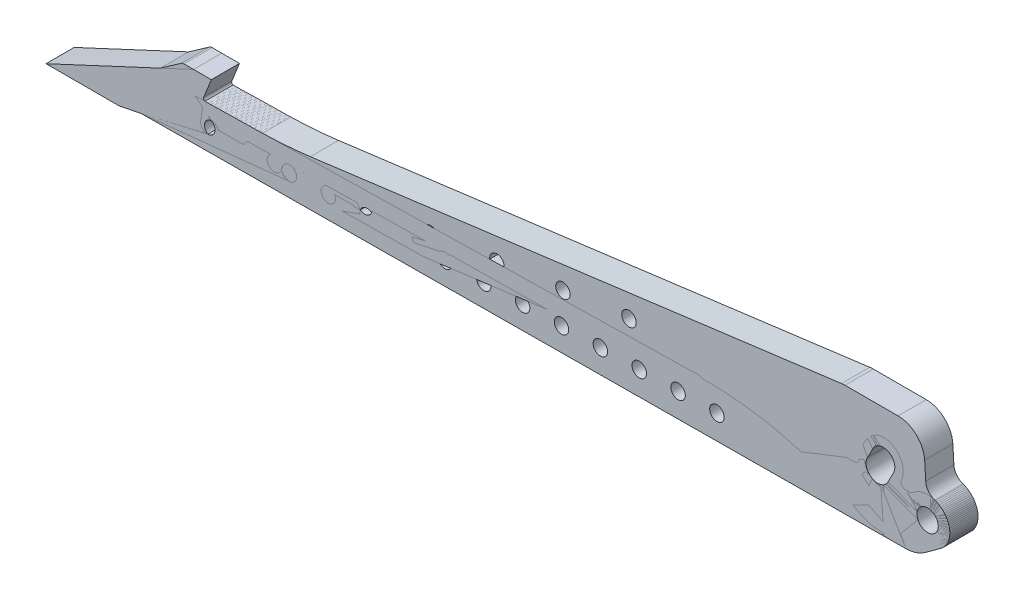
from build123d import *
from build123d.topology import SkipClean

# Parameters (mm, degrees)
SKETCH1_R                        = 3.2639
SKETCH1_R_2                      = 4.8025
BOSS_EXTRUDE1_DEPTH              = 12.7
EXTRUDE_THIN1_DEPTH              = 12.7
FILLET6_R                        = 2
FILLET3_R                        = 1
FILLET4_R                        = 2
BOSS_EXTRUDE5_START              = -12.7
BOSS_EXTRUDE5_DEPTH              = 12.7
CUT_EXTRUDE8_START               = -12.7
CUT_EXTRUDE8_DEPTH               = 12.7
FILLET13_R                       = 100
FILLET14_R                       = 2
CUT_EXTRUDE10_DEPTH              = 12.7
SKETCH19_R                       = 3.2639
BOSS_EXTRUDE7_DEPTH              = 6.35
FILLET17_R                       = 10
FILLET18_R                       = 5
CUT_EXTRUDE11_DEPTH              = 405.745522146
FILLET19_R                       = 5
DELETEFACE2_DEPTH                = 12.7
FILLET20_R                       = 15
BODY_MOVE_COPY1_OUTLINE_R        = 3.2639
BODY_MOVE_COPY1_OUTLINE_R_2      = 4.8025
BODY_MOVE_COPY1_DEPTH            = 12.7
BOSS_EXTRUDE8_DEPTH              = 12.7
FILLET21_R                       = 6
DELETEFACE3_OUTLINE_R            = 3.2639
DELETEFACE3_DEPTH                = 12.7
CUT_EXTRUDE12_DEPTH              = 378.065765561
FILLET22_R                       = 150
FILLET22_R_2                     = 30
FILLET22_R_3                     = 8
DELETEFACE4_DEPTH                = 12.7
MOVE_FACE1_DEPTH                 = 12.7
MOVE_FACE2_DEPTH                 = 12.7
MOVE_FACE2_2_DEPTH               = 12.7
FILLET23_R                       = 12
SKETCH25_W                       = 3.2639
SKETCH25_H                       = 12.7
F_1_4_CLEARANCE_HOLE1_AT_2_COUNT = 2
F_1_4_CLEARANCE_HOLE1_AT_2_PITCH = 40.943805732
F_1_4_CLEARANCE_HOLE1_AT_3_COUNT = 2
F_1_4_CLEARANCE_HOLE1_AT_3_PITCH = 70.874481639
F_1_4_CLEARANCE_HOLE1_AT_4_COUNT = 2
F_1_4_CLEARANCE_HOLE1_AT_4_PITCH = 120
F_1_4_CLEARANCE_HOLE1_AT_5_COUNT = 2
F_1_4_CLEARANCE_HOLE1_AT_5_PITCH = 90
F_1_4_CLEARANCE_HOLE1_AT_6_COUNT = 2
F_1_4_CLEARANCE_HOLE1_AT_6_PITCH = 60
F_1_4_CLEARANCE_HOLE1_AT_7_COUNT = 2
F_1_4_CLEARANCE_HOLE1_AT_7_PITCH = 30


# Read off the part's stored shape, not the designer's step: DeleteFace2, Body-Move/Copy1, DeleteFace3, DeleteFace4, Move Face1, Move Face2
with BuildPart() as part:
    # Sketch1 → Boss-Extrude1 (new body)
    with BuildSketch(Plane.XY):
        with BuildLine():
            Line((-356.801436578, 66.762186411), (-341.101436578, 66.762186411))
            Line((-341.101436578, 66.762186411), (-331.101436578, 68.762186411))
            Line((-331.101436578, 68.762186411), (18.198563422, 71.262186411))
            Line((18.198563422, 71.262186411), (29.067448443, 79.140508783))
            ThreePointArc((29.067448443, 79.140508783), (30.773671377, 93.765412775), (16.057134994, 94.237186411))
            Line((16.057134994, 94.237186411), (-308.528848369, 87.762186411))
            Line((-308.528848369, 87.762186411), (-304.528848369, 97.762186411))
            Line((-304.528848369, 97.762186411), (-312.528848369, 97.762186411))
            Line((-312.528848369, 97.762186411), (-356.801436578, 66.762186411))
        make_face()
        with Locations((-299.351436578, 78.467884124)):
            Circle(SKETCH1_R, mode=Mode.SUBTRACT)
        with Locations((-281.841436578, 78.705086211)):
            Circle(SKETCH1_R, mode=Mode.SUBTRACT)
        with Locations((-264.331436578, 78.942288297)):
            Circle(SKETCH1_R, mode=Mode.SUBTRACT)
        with Locations((-246.821436578, 79.179490384)):
            Circle(SKETCH1_R, mode=Mode.SUBTRACT)
        with Locations((-229.311436578, 79.41669247)):
            Circle(SKETCH1_R, mode=Mode.SUBTRACT)
        with Locations((-211.801436578, 79.653894557)):
            Circle(SKETCH1_R, mode=Mode.SUBTRACT)
        with BuildLine():
            ThreePointArc((-197.555037136, 79.846885743), (-194.335647478, 83.154697202), (-191.027836019, 79.935307544))
            ThreePointArc((-191.027836019, 79.935307544), (-194.247225677, 76.627496085), (-197.555037136, 79.846885743))
        make_face(mode=Mode.SUBTRACT)
        with BuildLine():
            ThreePointArc((-180.045037136, 80.08408783), (-176.825647478, 83.391899289), (-173.517836019, 80.17250963))
            ThreePointArc((-173.517836019, 80.17250963), (-176.737225677, 76.864698172), (-180.045037136, 80.08408783))
        make_face(mode=Mode.SUBTRACT)
        with BuildLine():
            ThreePointArc((-162.535037136, 80.321289917), (-159.315647478, 83.629101376), (-156.007836019, 80.409711717))
            ThreePointArc((-156.007836019, 80.409711717), (-159.227225677, 77.101900258), (-162.535037136, 80.321289917))
        make_face(mode=Mode.SUBTRACT)
        with BuildLine():
            ThreePointArc((-145.025037136, 80.558492003), (-141.805647478, 83.866303462), (-138.497836019, 80.646913804))
            ThreePointArc((-138.497836019, 80.646913804), (-141.717225677, 77.339102345), (-145.025037136, 80.558492003))
        make_face(mode=Mode.SUBTRACT)
        with Locations((-124.251436578, 80.83990499)):
            Circle(SKETCH1_R, mode=Mode.SUBTRACT)
        with Locations((-106.743043005, 81.077085315)):
            Circle(SKETCH1_R, mode=Mode.SUBTRACT)
        with Locations((-89.234649432, 81.31426564)):
            Circle(SKETCH1_R, mode=Mode.SUBTRACT)
        with Locations((-71.724649432, 81.551467727)):
            Circle(SKETCH1_R, mode=Mode.SUBTRACT)
        with BuildLine():
            ThreePointArc((-56.765451624, 76.725809773), (-61.828921392, 81.685493615), (-56.901716563, 86.780573837))
            Line((-56.901716563, 86.780573837), (11.656240235, 88.148201501))
            Line((11.656240235, 88.148201501), (15.713451777, 77.244553714))
            Line((15.713451777, 77.244553714), (-56.765451624, 76.725809773))
        make_face(mode=Mode.SUBTRACT)
        with Locations((23.198563422, 87.237186411)):
            Circle(SKETCH1_R_2, mode=Mode.SUBTRACT)
    extrude(amount=BOSS_EXTRUDE1_DEPTH)

    # Sketch3 → Extrude-Thin1 (add)
    with BuildSketch(Plane.XY.offset(12.7)):
        Polygon((4.266451459, 91.146855042), (3.251292658, 89.42364507), (-3.17085029, 78.522197177), (-4.186009091, 76.798987205), (0.552818334, 74.007300502), (1.567977134, 75.730510475), (7.990120082, 86.631958367), (9.005278883, 88.35516834), align=None)
        Polygon((-7.409121997, 76.81721423), (-8.469584737, 78.512920212), (-15.045003552, 89.027176482), (-16.105466292, 90.722882464), (-20.768657742, 87.806609928), (-19.708195001, 86.110903946), (-13.132776187, 75.596647676), (-12.072313446, 73.900941694), align=None)
        Polygon((-55.76358933, 87.210989988), (-54.70312659, 85.515284006), (-48.127707775, 75.001027736), (-47.067245035, 73.305321754), (-42.404053585, 76.22159429), (-43.464516326, 77.917300272), (-50.03993514, 88.431556542), (-51.100397881, 90.127262523), align=None)
        Polygon((-30.72848013, 90.551235102), (-31.743638931, 88.828025129), (-38.165781878, 77.926577237), (-39.180940679, 76.203367264), (-34.442113255, 73.411680562), (-33.426954454, 75.134890534), (-27.004811507, 86.036338427), (-25.989652706, 87.759548399), align=None)
    extrude(amount=-EXTRUDE_THIN1_DEPTH)

    # Fillet6
    fillet6_edges = [part.edges().sort_by_distance(p)[0] for p in [
        (-4.006668809, 77.103413429, 6.35),
        (2.391033949, 87.963374633, 6.35),
        (2.403795654, 77.149294223, 6.35),
        (8.850378791, 88.092228804, 6.35),
        (-14.030214252, 77.031673195, 6.35),
        (-20.580120846, 87.505134799, 6.35),
        (-7.572146672, 77.077894693, 6.35),
        (-14.173077707, 87.63294563, 6.35),
        (-38.797405337, 76.854410162, 6.35),
        (-32.664985126, 87.264060013, 6.35),
        (-32.386940873, 76.900290955, 6.35),
        (-26.205640285, 87.392914184, 6.35),
        (-49.240037595, 76.779670452, 6.35),
        (-55.511755473, 86.808301461, 6.35),
        (-42.781970016, 76.825891949, 6.35),
        (-49.104712334, 86.936112292, 6.35),
        (15.713451777, 77.244553714, 6.35),
        (11.656240235, 88.148201501, 6.35),
    ]]
    fillet(fillet6_edges, radius=FILLET6_R)

    # Fillet3
    fillet3_edges = [part.edges().sort_by_distance(p)[0] for p in [
        (-308.528848369, 87.762186411, 6.35),
    ]]
    fillet(fillet3_edges, radius=FILLET3_R)

    # Fillet4
    fillet4_edges = [part.edges().sort_by_distance(p)[0] for p in [
        (-312.528848369, 97.762186411, 6.35),
    ]]
    fillet(fillet4_edges, radius=FILLET4_R)

    # Sketch15 → Boss-Extrude5 (add)
    with BuildSketch(Plane(origin=(0, 0, 0), x_dir=(-1, 0, 0), z_dir=(0, 0, -1)).offset(BOSS_EXTRUDE5_START)):
        with BuildLine():
            ThreePointArc((-10.673905671, 95.845145196), (-10.129865813, 94.994321774), (-9.643534088, 94.109244762))
            Line((-9.643534088, 94.109244762), (-5.716381864, 94.030904008))
            ThreePointArc((-5.716381864, 94.030904008), (-5.937204944, 95.011972339), (-5.966921788, 96.01714636))
            ThreePointArc((-5.966921788, 96.01714636), (-5.552957699, 105.137562008), (2.068935542, 100.111620178))
            ThreePointArc((2.068935542, 100.111620178), (4.245314576, 97.349429423), (4.190127672, 93.833284109))
            Line((4.190127672, 93.833284109), (8.099749475, 93.755293061))
            ThreePointArc((8.099749475, 93.755293061), (8.195599303, 95.99531307), (7.722434089, 98.186885911))
            ThreePointArc((7.722434089, 98.186885911), (6.028678087, 102.129209778), (3.83483588, 105.816726997))
            ThreePointArc((3.83483588, 105.816726997), (-8.405325796, 108.085306872), (-10.673905671, 95.845145196))
        make_face()
        with BuildLine():
            ThreePointArc((1.190174188, 87.891934941), (-0.035420742, 87.502954243), (-0.770907429, 86.448227619))
            ThreePointArc((-0.770907429, 86.448227619), (1.801029811, 86.772839148), (4.166878038, 87.832554196))
            Line((4.166878038, 87.832554196), (1.190174188, 87.891934941))
        make_face()
    extrude(amount=BOSS_EXTRUDE5_DEPTH)

    # Sketch15<3> → Cut-Extrude8 (cut)
    with SkipClean():  # the faces are left unmerged after this step: merging them gives an invalid solid
        with BuildSketch(Plane(origin=(0, 0, 0), x_dir=(-1, 0, 0), z_dir=(0, 0, -1)).offset(CUT_EXTRUDE8_START)):
            with BuildLine():
                Line((4.190127672, 93.833284109), (-5.716381864, 94.030904008))
                ThreePointArc((-5.716381864, 94.030904008), (-0.833187407, 90.420033069), (4.190127672, 93.833284109))
            make_face()
        extrude(amount=CUT_EXTRUDE8_DEPTH, mode=Mode.SUBTRACT)

    # Fillet13
    fillet13_edges = [part.edges().sort_by_distance(p)[0] for p in [
        (5.966921788, 96.01714636, 6.35),
        (-2.068935542, 100.111620178, 6.35),
    ]]
    fillet(fillet13_edges, radius=FILLET13_R)

    # Fillet14
    fillet14_edges = [part.edges().sort_by_distance(p)[0] for p in [
        (16.057134994, 94.237186411, 6.35),
        (-8.099749475, 93.755293061, 6.35),
        (9.643534088, 94.109244762, 6.35),
    ]]
    fillet(fillet14_edges, radius=FILLET14_R)

    # original slant → Cut-Extrude10 (cut)
    with SkipClean():  # the faces are left unmerged after this step: merging them gives an invalid solid
        with BuildSketch(Plane(origin=(0, 0, 0), x_dir=(-1, 0, 0), z_dir=(0, 0, -1))):
            with BuildLine():
                Line((28.684666066, 98.558006822), (7.106994943, 99.790159701))
                ThreePointArc((7.106994943, 99.790159701), (7.671727903, 97.779168258), (7.746735366, 95.691733522))
                ThreePointArc((7.746735366, 95.691733522), (8.24962771, 94.192022343), (9.684666066, 93.526665861))
                Line((9.684666066, 93.526665861), (28.684666066, 93.002231288))
                Line((28.684666066, 93.002231288), (28.684666066, 98.558006822))
            make_face()
            Polygon((67.354716499, 96.349825333), (28.684666066, 98.558006822), (28.684666066, 93.002231288), (67.354716499, 93.002231288), align=None)
        extrude(amount=-CUT_EXTRUDE10_DEPTH, mode=Mode.SUBTRACT)

    # DeleteFace2 outline → DeleteFace2 (add)
    with SkipClean():  # the faces are left unmerged after this step: merging them gives an invalid solid
        with BuildSketch(Plane.XY):
            with BuildLine():
                ThreePointArc((-56.901716563, 86.780573837), (-61.828921392, 81.685493615), (-56.765451624, 76.725809773))
                Line((-56.765451624, 76.725809773), (-52.81933282, 76.754052822))
                ThreePointArc((-52.81933282, 76.754052822), (-51.080771522, 77.790970825), (-51.137940814, 79.814464339))
                Line((-51.137940814, 79.814464339), (-54.910286581, 85.846537921))
                ThreePointArc((-54.910286581, 85.846537921), (-55.654189981, 86.545072579), (-56.645881605, 86.785677358))
                Line((-56.645881605, 86.785677358), (-56.901716563, 86.780573837))
            make_face()
            with BuildLine():
                ThreePointArc((-43.374508777, 77.77337599), (-42.64183357, 77.080963456), (-41.664488819, 76.833889954))
                Line((-41.664488819, 76.833889954), (-39.930931875, 76.846297318))
                ThreePointArc((-39.930931875, 76.846297318), (-38.946646737, 77.113387241), (-38.222035879, 77.831087294))
                Line((-38.222035879, 77.831087294), (-34.483094249, 84.177859344))
                ThreePointArc((-34.483094249, 84.177859344), (-34.47986619, 86.202677357), (-36.246193264, 87.192620321))
                Line((-36.246193264, 87.192620321), (-45.579170729, 87.006441521))
                ThreePointArc((-45.579170729, 87.006441521), (-47.298279084, 85.958641926), (-47.234987668, 83.946376604))
                Line((-47.234987668, 83.946376604), (-43.374508777, 77.77337599))
            make_face()
            with BuildLine():
                ThreePointArc((-30.595835387, 79.940653539), (-30.605484269, 77.926895623), (-28.858311438, 76.925545961))
                Line((-28.858311438, 76.925545961), (-17.609509476, 77.006055566))
                ThreePointArc((-17.609509476, 77.006055566), (-15.870948178, 78.042973568), (-15.928117471, 80.066467083))
                Line((-15.928117471, 80.066467083), (-19.978651954, 86.543371259))
                ThreePointArc((-19.978651954, 86.543371259), (-20.722555354, 87.241905917), (-21.714246978, 87.482510696))
                Line((-21.714246978, 87.482510696), (-25.089143083, 87.415186617))
                ThreePointArc((-25.089143083, 87.415186617), (-26.058913252, 87.142022472), (-26.772464013, 86.430743241))
                Line((-26.772464013, 86.430743241), (-30.595835387, 79.940653539))
            make_face()
            with BuildLine():
                ThreePointArc((-8.164685434, 78.025378734), (-7.432010227, 77.3329662), (-6.454665476, 77.085892697))
                Line((-6.454665476, 77.085892697), (-5.140195348, 77.095300585))
                ThreePointArc((-5.140195348, 77.095300585), (-4.15591021, 77.362390508), (-3.431299352, 78.080090561))
                Line((-3.431299352, 78.080090561), (0.572924826, 84.877173964))
                ThreePointArc((0.572924826, 84.877173964), (0.834020748, 85.64227253), (0.770907429, 86.448227619))
                ThreePointArc((0.770907429, 86.448227619), (-1.801029811, 86.772839148), (-4.166878038, 87.832554196))
                Line((-4.166878038, 87.832554196), (-10.647536102, 87.703274859))
                ThreePointArc((-10.647536102, 87.703274859), (-12.366644457, 86.655475264), (-12.303353041, 84.643209942))
                Line((-12.303353041, 84.643209942), (-8.164685434, 78.025378734))
            make_face()
            with BuildLine():
                ThreePointArc((4.19490114, 80.189656806), (4.185252259, 78.175898891), (5.932425089, 77.174549229))
                Line((5.932425089, 77.174549229), (12.857228918, 77.224111237))
                ThreePointArc((12.857228918, 77.224111237), (14.48938723, 78.088661845), (14.717356381, 79.921533519))
                Line((14.717356381, 79.921533519), (12.151293007, 86.817760384))
                ThreePointArc((12.151293007, 86.817760384), (11.401698398, 87.773985644), (10.236962525, 88.119889055))
                Line((10.236962525, 88.119889055), (9.966875992, 88.114501237))
                ThreePointArc((9.966875992, 88.114501237), (8.997105823, 87.841337091), (8.283555062, 87.130057861))
                Line((8.283555062, 87.130057861), (4.19490114, 80.189656806))
            make_face()
        extrude(amount=DELETEFACE2_DEPTH)

    # Fillet20
    fillet20_edges = [part.edges().sort_by_distance(p)[0] for p in [
        (18.198563422, 71.262186411, 6.35),
    ]]
    fillet(fillet20_edges, radius=FILLET20_R)

    # Sketch21 → Boss-Extrude8 (add)
    with SkipClean():  # the faces are left unmerged after this step: merging them gives an invalid solid
        with BuildSketch(Plane(origin=(0, 0, 0), x_dir=(-1, 0, 0), z_dir=(0, 0, -1))):
            with BuildLine():
                Line((254.917284333, 90.029419342), (14.801436578, 121.284938536))
                Line((14.801436578, 121.284938536), (-21.198563422, 121.284938536))
                Line((-21.198563422, 121.284938536), (-22.612163948, 97.219978388))
                ThreePointArc((-22.612163948, 97.219978388), (-19.380958378, 96.47979923), (-16.569252423, 94.723990514))
                ThreePointArc((-16.569252423, 94.723990514), (-15.970975757, 94.358391515), (-15.283279266, 94.221749158))
                Line((-15.283279266, 94.221749158), (-13.209430329, 94.180379005))
                ThreePointArc((-13.209430329, 94.180379005), (-11.488793028, 95.095967671), (-11.364402404, 97.041069803))
                ThreePointArc((-11.364402404, 97.041069803), (-7.820925157, 108.454043732), (3.83483588, 105.816726997))
                ThreePointArc((3.83483588, 105.816726997), (5.628834916, 102.889186644), (7.106994943, 99.790159701))
                ThreePointArc((7.106994943, 99.790159701), (7.671727903, 97.779168258), (7.746735366, 95.691733522))
                ThreePointArc((7.746735366, 95.691733522), (8.24962771, 94.192022343), (9.684666066, 93.526665861))
                Line((9.684666066, 93.526665861), (28.684666066, 93.002231288))
                Line((28.684666066, 93.002231288), (277.019910035, 88.390742128))
                ThreePointArc((277.019910035, 88.390742128), (265.945880688, 88.903678601), (254.917284333, 90.029419342))
            make_face()
        extrude(amount=-BOSS_EXTRUDE8_DEPTH)

    # Fillet21
    fillet21_edges = [part.edges().sort_by_distance(p)[0] for p in [
        (22.612163948, 97.219978388, 6.35),
    ]]
    fillet(fillet21_edges, radius=FILLET21_R)

    # DeleteFace3 outline → DeleteFace3 (add)
    with SkipClean():  # the faces are left unmerged after this step: merging them gives an invalid solid
        with BuildSketch(Plane.XY):
            with Locations((-211.801436578, 79.653894557)):
                Circle(DELETEFACE3_OUTLINE_R)
            with Locations((-106.743043005, 81.077085315)):
                Circle(DELETEFACE3_OUTLINE_R)
            with Locations((-89.234649432, 81.31426564)):
                Circle(DELETEFACE3_OUTLINE_R)
            with Locations((-71.724649432, 81.551467727)):
                Circle(DELETEFACE3_OUTLINE_R)
            with Locations((-229.311436578, 79.41669247)):
                Circle(DELETEFACE3_OUTLINE_R)
            with Locations((-246.821436578, 79.179490384)):
                Circle(DELETEFACE3_OUTLINE_R)
            with Locations((-264.331436578, 78.942288297)):
                Circle(DELETEFACE3_OUTLINE_R)
            with Locations((-281.841436578, 78.705086211)):
                Circle(DELETEFACE3_OUTLINE_R)
            with Locations((-299.351436578, 78.467884124)):
                Circle(DELETEFACE3_OUTLINE_R)
            with Locations((-194.291436578, 79.891096644)):
                Circle(DELETEFACE3_OUTLINE_R)
            with Locations((-176.781436578, 80.12829873)):
                Circle(DELETEFACE3_OUTLINE_R)
            with Locations((-159.271436578, 80.365500817)):
                Circle(DELETEFACE3_OUTLINE_R)
            with Locations((-141.761436578, 80.602702904)):
                Circle(DELETEFACE3_OUTLINE_R)
            with Locations((-124.251436578, 80.83990499)):
                Circle(DELETEFACE3_OUTLINE_R)
        extrude(amount=DELETEFACE3_DEPTH)

    # Sketch22 → Cut-Extrude12 (cut, through all)
    with SkipClean():  # the faces are left unmerged after this step: merging them gives an invalid solid
        with BuildSketch(Plane(origin=(0, 0, 0), x_dir=(-1, 0, 0), z_dir=(0, 0, -1))):
            Polygon((259.414782612, 69.275260086), (50.092085209, 96.522481158), (0.256728678, 71.13009872), align=None)
        extrude(amount=-CUT_EXTRUDE12_DEPTH, mode=Mode.SUBTRACT)

    # Fillet22
    # the kernel refuses this fillet: 150, 30, 8 mm, written as the material it adds along each edge
    with BuildSketch(Plane(origin=(-50.092085209, 96.522481158, 0), x_dir=(0.8910065241883672, -0.45399049973954797, 0), z_dir=(0, 0, 1))) as fillet22_piece_1:
        with BuildLine():
            CenterArc((FILLET22_R * 0.309708601666, -FILLET22_R), FILLET22_R, 90, 34.416405691)
            Line((-FILLET22_R * 0.25549463608, -FILLET22_R * 0.17504830442), (0, 0))
            Line((0, 0), (FILLET22_R * 0.309708601666, 0))
        make_face()
    extrude(amount=12.7)
    # the kernel refuses this fillet: 150, 30, 8 mm, written as the material it takes off along each edge
    with BuildSketch(Plane(origin=(-0.256728678, 71.13009872, -18.290010948), x_dir=(0.9999743884321234, 0.007156988179445303, 0), z_dir=(0, 0, 1))) as fillet22_2_piece_1:
        with BuildLine():
            CenterArc((FILLET22_R_2 * 0.243866812637, FILLET22_R_2), FILLET22_R_2, 242.589931282, 27.410068718)
            Line((-FILLET22_R_2 * 0.216488982855, FILLET22_R_2 * 0.112265500526), (0, 0))
            Line((0, 0), (FILLET22_R_2 * 0.243866812637, 0))
        make_face()
    extrude(amount=49.280021896, mode=Mode.SUBTRACT)
    with BuildSketch(Plane(origin=(-259.414782612, 69.275260086, -1.224362555), x_dir=(0.9916342432612403, 0.12907953978732387, 0), z_dir=(0, 0, 1))) as fillet22_2_piece_2:
        with BuildLine():
            CenterArc((FILLET22_R_3 * 0.0612181277324, FILLET22_R_3), FILLET22_R_3, 262.993663027, 7.006336973)
            Line((-FILLET22_R_3 * 0.0607609915682, FILLET22_R_3 * 0.00746733330602), (0, 0))
            Line((0, 0), (FILLET22_R_3 * 0.0612181277324, 0))
        make_face()
    extrude(amount=15.148725109, mode=Mode.SUBTRACT)

    # DeleteFace4 outline → DeleteFace4 (add)
    with SkipClean():  # the faces are left unmerged after this step: merging them gives an invalid solid
        with BuildSketch(Plane.XY):
            with BuildLine():
                Line((-312.528848369, 97.762186411), (-313.045403664, 97.400490499))
                ThreePointArc((-313.045403664, 97.400490499), (-312.49966239, 97.669620312), (-311.898250791, 97.762186411))
                Line((-311.898250791, 97.762186411), (-312.528848369, 97.762186411))
            make_face()
        extrude(amount=DELETEFACE4_DEPTH)

    # Move Face1 outline → Move Face1 (add)
    with SkipClean():  # the faces are left unmerged after this step: merging them gives an invalid solid
        with BuildSketch(Plane.XY):
            Polygon((-312.528848369, 97.762186411), (-379.008562904, 66.762186411), (-356.801436578, 66.762186411), (-313.045403664, 97.400490499), align=None)
        extrude(amount=MOVE_FACE1_DEPTH)

    # Move Face2 outline → Move Face2 (cut)
    with SkipClean():  # the faces are left unmerged after this step: merging them gives an invalid solid
        with BuildSketch(Plane.XY):
            with BuildLine():
                Line((-301.586668861, 87.900672404), (-302.457129047, 87.883308038))
                ThreePointArc((-302.457129047, 87.883308038), (-302.019910034, 87.792287451), (-301.586668861, 87.900672404))
            make_face()
            Polygon((-374.008562904, 66.762186411), (-307.528848369, 97.762186411), (-312.528848369, 97.762186411), (-379.008562904, 66.762186411), align=None)
        extrude(amount=MOVE_FACE2_DEPTH, mode=Mode.SUBTRACT)

    # Move Face2 2 outline → Move Face2 2 (add)
    with SkipClean():  # the faces are left unmerged after this step: merging them gives an invalid solid
        with BuildSketch(Plane.XY):
            with BuildLine():
                ThreePointArc((-302.457129047, 87.883308038), (-302.968547789, 88.421239677), (-302.968331247, 89.163479215))
                Line((-302.968331247, 89.163479215), (-299.528848369, 97.762186411))
                Line((-299.528848369, 97.762186411), (-304.528848369, 97.762186411))
                Line((-304.528848369, 97.762186411), (-307.968331247, 89.163479215))
                ThreePointArc((-307.968331247, 89.163479215), (-307.862289593, 88.223229496), (-307.019910035, 87.792287451))
                Line((-307.019910035, 87.792287451), (-302.457129047, 87.883308038))
            make_face()
        extrude(amount=MOVE_FACE2_2_DEPTH)

    # Fillet23
    fillet23_edges = [part.edges().sort_by_distance(p)[0] for p in [
        (-14.801436578, 121.284938536, 6.35),
        (21.198563422, 121.284938536, 6.35),
    ]]
    fillet(fillet23_edges, radius=FILLET23_R)

    # Sketch25 → 1/4 Clearance Hole1 (revolve, cut)
    with SkipClean():  # the faces are left unmerged after this step: merging them gives an invalid solid
        with BuildSketch(Plane(origin=(-230.349490795, 83.14300879, 0), x_dir=(0, 1, 0), z_dir=(1, 0, 0))):
            with Locations((1.63195, 6.35)):
                Rectangle(SKETCH25_W, SKETCH25_H)
        f_1_4_clearance_hole1 = revolve(axis=Axis((-230.349490795, 83.14300879, -6.35), (0, 0, 1)), mode=Mode.SUBTRACT)

    # 1/4 Clearance Hole1 at 2: 1/4 Clearance Hole1 ×2
    with SkipClean():  # the faces are left unmerged after this step: merging them gives an invalid solid
        with Locations(*[Vector(-0.9953328324267502, -0.09650156834654611, 0) * (i * F_1_4_CLEARANCE_HOLE1_AT_2_PITCH) for i in range(1, F_1_4_CLEARANCE_HOLE1_AT_2_COUNT)]):
            add(f_1_4_clearance_hole1, mode=Mode.SUBTRACT)

    # 1/4 Clearance Hole1 at 3: 1/4 Clearance Hole1 ×2
    with SkipClean():  # the faces are left unmerged after this step: merging them gives an invalid solid
        with Locations(*[Vector(-0.9982710863910461, -0.058777870628668454, 0) * (i * F_1_4_CLEARANCE_HOLE1_AT_3_PITCH) for i in range(1, F_1_4_CLEARANCE_HOLE1_AT_3_COUNT)]):
            add(f_1_4_clearance_hole1, mode=Mode.SUBTRACT)

    # 1/4 Clearance Hole1 at 4: 1/4 Clearance Hole1 ×2
    with SkipClean():  # the faces are left unmerged after this step: merging them gives an invalid solid
        with Locations(*[Vector(0.9916342432612381, 0.12907953978734113, 0) * (i * F_1_4_CLEARANCE_HOLE1_AT_4_PITCH) for i in range(1, F_1_4_CLEARANCE_HOLE1_AT_4_COUNT)]):
            add(f_1_4_clearance_hole1, mode=Mode.SUBTRACT)

    # 1/4 Clearance Hole1 at 5: 1/4 Clearance Hole1 ×2
    with SkipClean():  # the faces are left unmerged after this step: merging them gives an invalid solid
        with Locations(*[Vector(0.9916342432612381, 0.12907953978734119, 0) * (i * F_1_4_CLEARANCE_HOLE1_AT_5_PITCH) for i in range(1, F_1_4_CLEARANCE_HOLE1_AT_5_COUNT)]):
            add(f_1_4_clearance_hole1, mode=Mode.SUBTRACT)

    # 1/4 Clearance Hole1 at 6: 1/4 Clearance Hole1 ×2
    with SkipClean():  # the faces are left unmerged after this step: merging them gives an invalid solid
        with Locations(*[Vector(0.9916342432612381, 0.1290795397873412, 0) * (i * F_1_4_CLEARANCE_HOLE1_AT_6_PITCH) for i in range(1, F_1_4_CLEARANCE_HOLE1_AT_6_COUNT)]):
            add(f_1_4_clearance_hole1, mode=Mode.SUBTRACT)

    # 1/4 Clearance Hole1 at 7: 1/4 Clearance Hole1 ×2
    with SkipClean():  # the faces are left unmerged after this step: merging them gives an invalid solid
        with Locations(*[Vector(0.9916342432612381, 0.12907953978734105, 0) * (i * F_1_4_CLEARANCE_HOLE1_AT_7_PITCH) for i in range(1, F_1_4_CLEARANCE_HOLE1_AT_7_COUNT)]):
            add(f_1_4_clearance_hole1, mode=Mode.SUBTRACT)


with BuildPart() as body_2:
    # Sketch19 → Boss-Extrude7 (new body)
    with BuildSketch(Plane(origin=(0, 0, 0), x_dir=(-1, 0, 0), z_dir=(0, 0, -1))):
        with BuildLine():
            Line((124.18275106, 71.243164539), (176.715153171, 70.867181128))
            ThreePointArc((176.715153171, 70.867181128), (184.899057561, 75.669944516), (184.561210792, 85.153018214))
            Line((184.561210792, 85.153018214), (149.054349601, 140.12829873))
            Line((149.054349601, 140.12829873), (162.836097859, 190.12829873))
            Line((162.836097859, 190.12829873), (144.420262397, 190.12829873))
            Line((144.420262397, 190.12829873), (114.999474247, 83.390069305))
            ThreePointArc((114.999474247, 83.390069305), (116.596017391, 75.052271444), (124.18275106, 71.243164539))
        make_face()
        with Locations(Location((124.251436578, 80.83990499, 0), (0, 0, 180))):
            Circle(SKETCH19_R, mode=Mode.SUBTRACT)
        with Locations(Location((176.781436578, 80.12829873, 0), (0, 0, 180))):
            Circle(SKETCH19_R, mode=Mode.SUBTRACT)
        with Locations(Location((159.271436578, 80.365500817, 0), (0, 0, 180))):
            Circle(SKETCH19_R, mode=Mode.SUBTRACT)
        with Locations(Location((141.761436578, 80.602702904, 0), (0, 0, 180))):
            Circle(SKETCH19_R, mode=Mode.SUBTRACT)
    extrude(amount=BOSS_EXTRUDE7_DEPTH)

    # Fillet17
    fillet17_edges = [body_2.edges().sort_by_distance(p)[0] for p in [
        (-149.054349601, 140.12829873, -3.175),
    ]]
    fillet(fillet17_edges, radius=FILLET17_R)

    # Fillet18
    fillet18_edges = [body_2.edges().sort_by_distance(p)[0] for p in [
        (-144.420262397, 190.12829873, -3.175),
        (-162.836097859, 190.12829873, -3.175),
    ]]
    fillet(fillet18_edges, radius=FILLET18_R)

    # Sketch20 → Cut-Extrude11 (cut, through all)
    with BuildSketch(Plane(origin=(0, 0, -6.35), x_dir=(-1, 0, 0), z_dir=(0, 0, -1))):
        Polygon((164.044210392, 92.958432708), (140.969247478, 128.685402552), (131.186466054, 93.193601219), align=None)
    extrude(amount=-CUT_EXTRUDE11_DEPTH, mode=Mode.SUBTRACT)

    # Fillet19
    fillet19_edges = [body_2.edges().sort_by_distance(p)[0] for p in [
        (-131.186466054, 93.193601219, -3.175),
        (-140.969247478, 128.685402552, -3.175),
        (-164.044210392, 92.958432708, -3.175),
    ]]
    fillet(fillet19_edges, radius=FILLET19_R)


with BuildPart() as body_2_2:
    # Body-Move/Copy1 outline → Body-Move/Copy1 (new body)
    with BuildSketch(Plane.XY):
        with BuildLine():
            Line((15.283279266, 94.221749158), (13.209430329, 94.180379005))
            ThreePointArc((13.209430329, 94.180379005), (11.488793028, 95.095967672), (11.364402404, 97.041069803))
            ThreePointArc((11.364402404, 97.041069803), (7.820925157, 108.454043732), (-3.83483588, 105.816726997))
            ThreePointArc((-3.83483588, 105.816726997), (-5.628834916, 102.889186644), (-7.106994943, 99.790159701))
            ThreePointArc((-7.106994943, 99.790159701), (-7.671727903, 97.779168258), (-7.746735366, 95.691733522))
            ThreePointArc((-7.746735366, 95.691733522), (-8.24962771, 94.192022343), (-9.684666066, 93.526665861))
            Line((-9.684666066, 93.526665861), (-28.684666066, 93.002231288))
            Line((-28.684666066, 93.002231288), (-45.850065454, 93.002231288))
            Line((-45.850065454, 93.002231288), (-307.019910035, 87.792287451))
            ThreePointArc((-307.019910035, 87.792287451), (-307.862289593, 88.223229496), (-307.968331247, 89.163479215))
            Line((-307.968331247, 89.163479215), (-304.528848369, 97.762186411))
            Line((-304.528848369, 97.762186411), (-311.898250791, 97.762186411))
            ThreePointArc((-311.898250791, 97.762186411), (-312.49966239, 97.669620312), (-313.045403664, 97.400490499))
            Line((-313.045403664, 97.400490499), (-356.801436578, 66.762186411))
            Line((-356.801436578, 66.762186411), (-341.101436578, 66.762186411))
            Line((-341.101436578, 66.762186411), (-331.101436578, 68.762186411))
            Line((-331.101436578, 68.762186411), (13.393331634, 71.227794543))
            ThreePointArc((13.393331634, 71.227794543), (17.964357879, 71.9756473), (22.089304342, 74.082393927))
            Line((22.089304342, 74.082393927), (29.067448443, 79.140508783))
            ThreePointArc((29.067448443, 79.140508783), (30.999575384, 93.493719985), (16.569252423, 94.723990514))
            ThreePointArc((16.569252423, 94.723990514), (15.970975757, 94.358391515), (15.283279266, 94.221749158))
        make_face()
        with Locations((-299.351436578, 78.467884124)):
            Circle(BODY_MOVE_COPY1_OUTLINE_R, mode=Mode.SUBTRACT)
        with Locations((-281.841436578, 78.705086211)):
            Circle(BODY_MOVE_COPY1_OUTLINE_R, mode=Mode.SUBTRACT)
        with Locations((-264.331436578, 78.942288297)):
            Circle(BODY_MOVE_COPY1_OUTLINE_R, mode=Mode.SUBTRACT)
        with Locations((-246.821436578, 79.179490384)):
            Circle(BODY_MOVE_COPY1_OUTLINE_R, mode=Mode.SUBTRACT)
        with Locations((-229.311436578, 79.41669247)):
            Circle(BODY_MOVE_COPY1_OUTLINE_R, mode=Mode.SUBTRACT)
        with Locations((-211.801436578, 79.653894557)):
            Circle(BODY_MOVE_COPY1_OUTLINE_R, mode=Mode.SUBTRACT)
        with Locations((-194.291436578, 79.891096644)):
            Circle(BODY_MOVE_COPY1_OUTLINE_R, mode=Mode.SUBTRACT)
        with Locations((-176.781436578, 80.12829873)):
            Circle(BODY_MOVE_COPY1_OUTLINE_R, mode=Mode.SUBTRACT)
        with Locations((-159.271436578, 80.365500817)):
            Circle(BODY_MOVE_COPY1_OUTLINE_R, mode=Mode.SUBTRACT)
        with Locations((-141.761436578, 80.602702904)):
            Circle(BODY_MOVE_COPY1_OUTLINE_R, mode=Mode.SUBTRACT)
        with Locations((-124.251436578, 80.83990499)):
            Circle(BODY_MOVE_COPY1_OUTLINE_R, mode=Mode.SUBTRACT)
        with Locations((-106.743043005, 81.077085315)):
            Circle(BODY_MOVE_COPY1_OUTLINE_R, mode=Mode.SUBTRACT)
        with Locations((-89.234649432, 81.31426564)):
            Circle(BODY_MOVE_COPY1_OUTLINE_R, mode=Mode.SUBTRACT)
        with Locations((-71.724649432, 81.551467727)):
            Circle(BODY_MOVE_COPY1_OUTLINE_R, mode=Mode.SUBTRACT)
        with Locations((23.198563422, 87.237186411)):
            Circle(BODY_MOVE_COPY1_OUTLINE_R_2, mode=Mode.SUBTRACT)
        with BuildLine():
            ThreePointArc((7.784884797, 97.957620066), (6.596179451, 95.696523567), (5.465617428, 93.405801564))
            ThreePointArc((5.465617428, 93.405801564), (-1.654971454, 90.99120453), (-3.886898551, 98.171146472))
            ThreePointArc((-3.886898551, 98.171146472), (-2.698193205, 100.432242972), (-1.567631182, 102.722964975))
            ThreePointArc((-1.567631182, 102.722964975), (5.5529577, 105.137562008), (7.784884797, 97.957620066))
        make_face(mode=Mode.SUBTRACT)
    extrude(amount=BODY_MOVE_COPY1_DEPTH)


solid = Compound([part.part, body_2_2.part])
